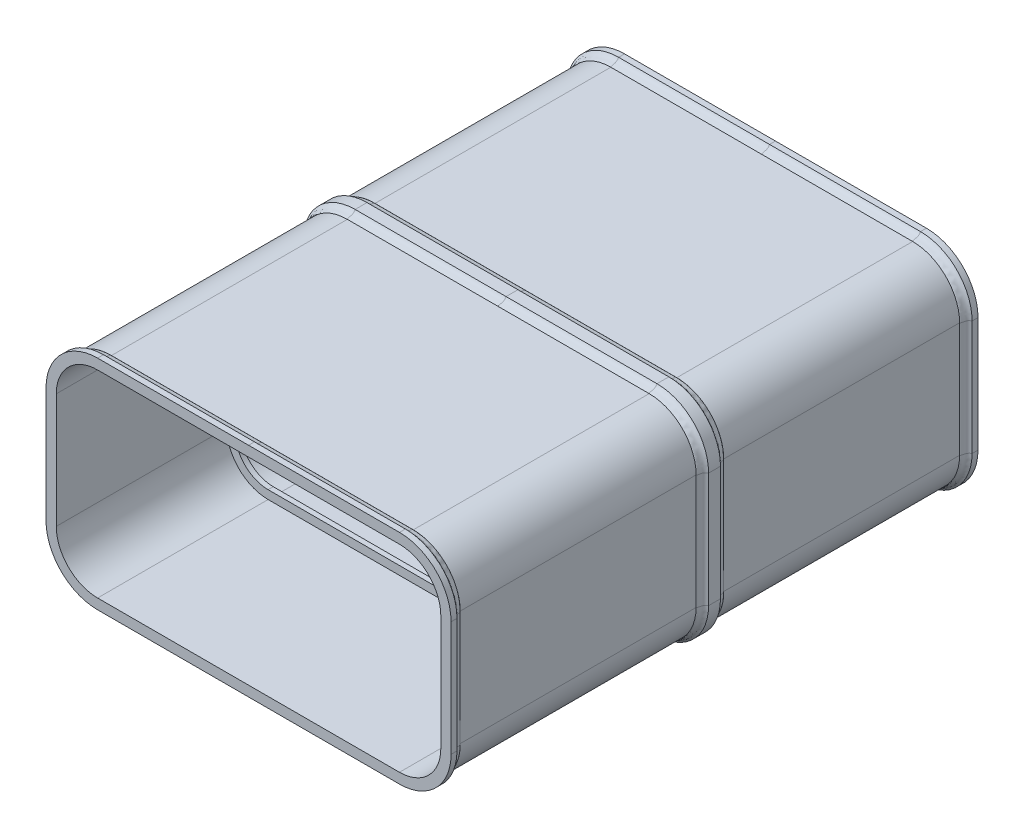
from build123d import *

# Parameters (mm, degrees)
BOSS_EXTRUDE1_DEPTH     = 154
LPATTERN1_COUNT         = 3
LPATTERN1_PITCH         = 154.008888959
CUT_EXTRUDE2_DEPTH      = 292.712374669
CUT_EXTRUDE2_DEPTH_BACK = 292.712374669
SKETCH4_W               = 127.836637365
SKETCH4_H               = 196.790531689
CUT_EXTRUDE3_DEPTH      = 337.043580725
CUT_EXTRUDE3_DEPTH_BACK = 337.043580725
BOSS_EXTRUDE2_DEPTH     = 3
FILLET1_R               = 1
LPATTERN2_COUNT         = 3
LPATTERN2_PITCH         = 102.66


with BuildPart() as part:
    # Sketch1 → Boss-Extrude1 (new, symmetric)
    with BuildSketch(Plane.XY):
        with BuildLine():
            Line((115.641625723, -33.547344863), (115.641625723, 33.547344863))
            ThreePointArc((115.641625723, 33.547344863), (107.608933118, 52.939980291), (88.21629769, 60.972672896))
            Line((88.21629769, 60.972672896), (-88.21629769, 60.972672896))
            ThreePointArc((-88.21629769, 60.972672896), (-107.608933118, 52.939980291), (-115.641625723, 33.547344863))
            Line((-115.641625723, 33.547344863), (-115.641625723, -33.547344863))
            ThreePointArc((-115.641625723, -33.547344863), (-107.608933118, -52.939980291), (-88.21629769, -60.972672896))
            Line((-88.21629769, -60.972672896), (88.21629769, -60.972672896))
            ThreePointArc((88.21629769, -60.972672896), (107.608933118, -52.939980291), (115.641625723, -33.547344863))
        make_face()
    extrude(amount=BOSS_EXTRUDE1_DEPTH, both=True)

    # Sweep3: sweep along a path in Sketch3
    with BuildLine(Plane(origin=(0, 0, -154), x_dir=(-1, 0, 0), z_dir=(0, 0, -1))) as sweep3_path:
        Line((115.641625723, 33.547344863), (115.641625723, -33.547344863))
        ThreePointArc((115.641625723, -33.547344863), (107.608933118, -52.939980291), (88.21629769, -60.972672896))
        Line((88.21629769, -60.972672896), (-88.21629769, -60.972672896))
        ThreePointArc((-88.21629769, -60.972672896), (-107.608933118, -52.939980291), (-115.641625723, -33.547344863))
        Line((-115.641625723, -33.547344863), (-115.641625723, 33.547344863))
        ThreePointArc((-115.641625723, 33.547344863), (-107.608933118, 52.939980291), (-88.21629769, 60.972672896))
        Line((-88.21629769, 60.972672896), (88.21629769, 60.972672896))
        ThreePointArc((88.21629769, 60.972672896), (107.608933118, 52.939980291), (115.641625723, 33.547344863))
    # Sketch2 → Sweep3 (sweep)
    with BuildSketch(Plane(origin=(0, 0, 0), x_dir=(0, 0, -1), z_dir=(1, 0, 0))):
        with BuildLine():
            Line((150.529708134, 63.712930218), (157.470291866, 63.712930218))
            add(Edge.make_bspline(
                [(162.061737477, 60.873017408), (162.042061601, 60.939041135), (161.981164654, 61.084162877), (161.903565095, 61.182658437), (161.802319136, 61.273366008), (161.595616712, 61.392483219), (161.159106133, 61.530900053), (160.424012106, 61.660687916), (159.563511573, 61.84635139), (158.800986282, 62.176804723), (158.231171684, 62.62278949), (157.850144311, 63.087927481), (157.660150897, 63.416906852), (157.535544974, 63.618679436), (157.495196936, 63.679074492), (157.470291866, 63.712930218)],
                knots=[0.125807919, 0.125807919, 0.125807919, 0.125807919, 0.180444924, 0.235081929, 0.289718934, 0.344355939, 0.453629949, 0.562903959, 0.672177969, 0.78145198, 0.836088985, 0.89072599, 0.945362995, 0.972681497, 1, 1, 1, 1], degree=3))
            Line((162.061737477, 60.873017408), (145.938262523, 60.873017408))
            add(Edge.make_bspline(
                [(150.529708134, 63.712930218), (150.504803064, 63.679074492), (150.464455026, 63.618679436), (150.339849103, 63.416906852), (150.149855689, 63.087927481), (149.768828316, 62.62278949), (149.199013718, 62.176804723), (148.436488427, 61.84635139), (147.575987894, 61.660687916), (146.840893867, 61.530900053), (146.404383288, 61.392483219), (146.197680864, 61.273366008), (146.096434905, 61.182658437), (146.018835346, 61.084162877), (145.957938399, 60.939041135), (145.938262523, 60.873017408)],
                knots=[0.125807919, 0.125807919, 0.125807919, 0.125807919, 0.153126421, 0.180444924, 0.235081929, 0.289718934, 0.344355939, 0.453629949, 0.562903959, 0.672177969, 0.78145198, 0.836088985, 0.89072599, 0.945362995, 1, 1, 1, 1], degree=3))
        make_face()
    sweep3 = sweep(path=sweep3_path.line)

    # LPattern1: Sweep3 ×3
    with Locations(*[(0, 0, i * LPATTERN1_PITCH) for i in range(1, LPATTERN1_COUNT)]):
        add(sweep3)

    # Sketch4 → Cut-Extrude2 (cut, two sides: drawn at the far end of the back side and taken through both)
    with BuildSketch(Plane.ZY.offset(115.641625723).offset(-CUT_EXTRUDE2_DEPTH_BACK)):
        Polygon((-153.99, 60.972672896), (-153.99, -60.972672896), (-153.99, -86.923159703), (-259.855172325, -86.923159703), (-259.855172325, 97.916529981), (-153.99, 97.916529981), align=None)
        with Locations((217.908318683, -0.478735863)):
            Rectangle(SKETCH4_W, SKETCH4_H)
    extrude(amount=CUT_EXTRUDE2_DEPTH + CUT_EXTRUDE2_DEPTH_BACK, mode=Mode.SUBTRACT)

    # Sketch6 → Cut-Extrude3 (cut, two sides: drawn at the far end of the back side and taken through both)
    with BuildSketch(Plane.XY.offset(153.99).offset(-CUT_EXTRUDE3_DEPTH_BACK)):
        with BuildLine():
            Line((-88.21629769, -57.712930218), (88.21629769, -57.712930218))
            ThreePointArc((88.21629769, -57.712930218), (105.303946966, -50.634994139), (112.381883045, -33.547344863))
            Line((112.381883045, -33.547344863), (112.381883045, 33.547344863))
            ThreePointArc((112.381883045, 33.547344863), (105.303946966, 50.634994139), (88.21629769, 57.712930218))
            Line((88.21629769, 57.712930218), (0, 57.712930218))
            Line((0, 57.712930218), (-88.21629769, 57.712930218))
            ThreePointArc((-88.21629769, 57.712930218), (-105.303946966, 50.634994139), (-112.381883045, 33.547344863))
            Line((-112.381883045, 33.547344863), (-112.381883045, -33.547344863))
            ThreePointArc((-112.381883045, -33.547344863), (-105.303946966, -50.634994139), (-88.21629769, -57.712930218))
        make_face()
    extrude(amount=CUT_EXTRUDE3_DEPTH + CUT_EXTRUDE3_DEPTH_BACK, mode=Mode.SUBTRACT)

    # Sketch9 → Boss-Extrude2 (add)
    with BuildSketch(Plane(origin=(0, 0, -153.99), x_dir=(-1, 0, 0), z_dir=(0, 0, -1))):
        with BuildLine():
            Line((112.381883045, 33.547344863), (112.381883045, -33.547344863))
            ThreePointArc((112.381883045, -33.547344863), (105.303946966, -50.634994139), (88.21629769, -57.712930218))
            Line((88.21629769, -57.712930218), (-88.21629769, -57.712930218))
            ThreePointArc((-88.21629769, -57.712930218), (-105.303946966, -50.634994139), (-112.381883045, -33.547344863))
            Line((-112.381883045, -33.547344863), (-112.381883045, 33.547344863))
            ThreePointArc((-112.381883045, 33.547344863), (-105.303946966, 50.634994139), (-88.21629769, 57.712930218))
            Line((-88.21629769, 57.712930218), (88.21629769, 57.712930218))
            ThreePointArc((88.21629769, 57.712930218), (105.303946966, 50.634994139), (112.381883045, 33.547344863))
        make_face()
        with BuildLine():
            Line((-107.381883045, -33.547344863), (-107.381883045, 33.547344863))
            ThreePointArc((-107.381883045, 33.547344863), (-101.76841306, 47.099460233), (-88.21629769, 52.712930218))
            Line((-88.21629769, 52.712930218), (88.21629769, 52.712930218))
            ThreePointArc((88.21629769, 52.712930218), (101.76841306, 47.099460233), (107.381883045, 33.547344863))
            Line((107.381883045, 33.547344863), (107.381883045, -33.547344863))
            ThreePointArc((107.381883045, -33.547344863), (101.76841306, -47.099460233), (88.21629769, -52.712930218))
            Line((88.21629769, -52.712930218), (-88.21629769, -52.712930218))
            ThreePointArc((-88.21629769, -52.712930218), (-101.76841306, -47.099460233), (-107.381883045, -33.547344863))
        make_face(mode=Mode.SUBTRACT)
    boss_extrude2 = extrude(amount=-BOSS_EXTRUDE2_DEPTH)

    # Fillet1
    fillet1_edges = [part.edges().sort_by_distance(p)[0] for p in [
        (-101.76841306, 47.099460233, -150.99),
        (-107.381883045, 0, -150.99),
        (-101.76841306, -47.099460233, -150.99),
        (0, -52.712930218, -150.99),
        (101.76841306, -47.099460233, -150.99),
        (107.381883045, 0, -150.99),
        (101.76841306, 47.099460233, -150.99),
        (-101.76841306, 47.099460233, -153.99),
        (-107.381883045, 0, -153.99),
        (-101.76841306, -47.099460233, -153.99),
        (0, -52.712930218, -153.99),
        (101.76841306, -47.099460233, -153.99),
        (107.381883045, 0, -153.99),
        (101.76841306, 47.099460233, -153.99),
        (0, 52.712930218, -150.99),
        (0, 52.712930218, -153.99),
    ]]
    fillet(fillet1_edges, radius=FILLET1_R)

    # LPattern2: Boss-Extrude2 ×3
    with Locations(*[(0, 0, i * LPATTERN2_PITCH) for i in range(1, LPATTERN2_COUNT)]):
        add(boss_extrude2)


solid = part.part
